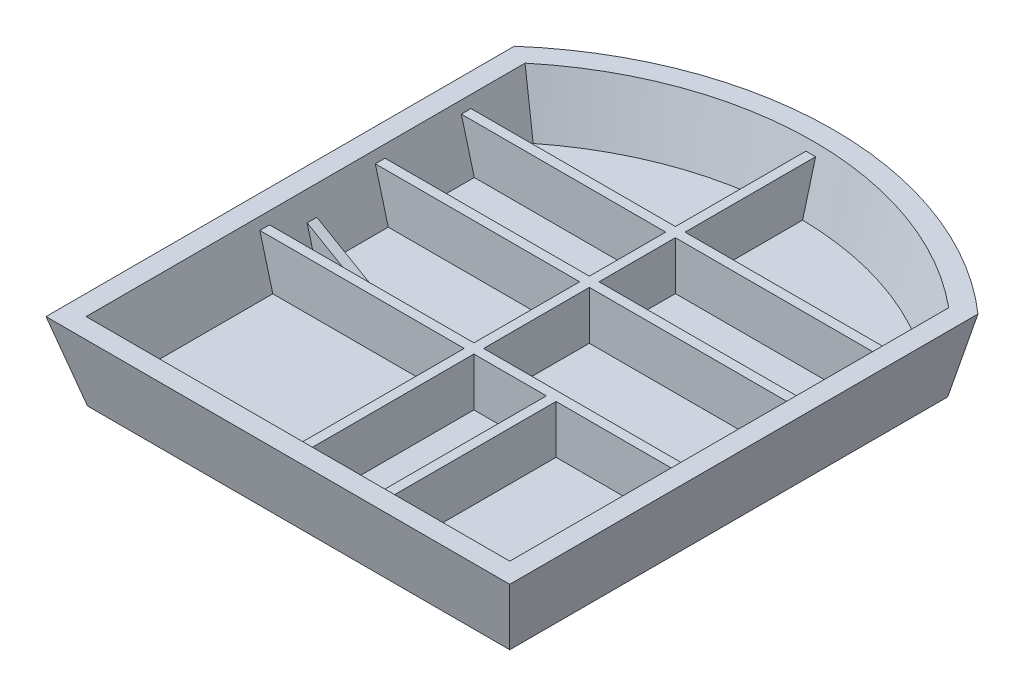
from build123d import *

# Parameters (mm, degrees)
BOSS_EXTRUDE1_DEPTH = 40
BOSS_EXTRUDE1_DRAFT = -15
SHELL1_T            = -10
RIB7_REACH          = 207.359
SKETCH5_WALLS_W     = 5
SKETCH5_WALLS_H     = 549.174801164
SKETCH5_WALLS_W_2   = 496.753269208
SKETCH5_WALLS_H_2   = 5
SKETCH5_WALLS_W_3   = 472.743407243
SKETCH5_WALLS_W_4   = 484.34817386
RIB8_REACH          = 207.359
SKETCH6_WALLS_W     = 5
SKETCH6_WALLS_H     = 444.331737252
RIB9_REACH          = 208.27
SKETCH7_WALL_W      = 435.628467694
SKETCH7_WALL_H      = 5


with BuildPart() as part:
    # Sketch1 → Boss-Extrude1 (with draft: the straight prism first)
    with BuildSketch(Plane(origin=(0, 0, 0), x_dir=(1, 0, 0), z_dir=(0, 1, 0))):
        with BuildLine():
            Line((-109.029856613, -113.081906669), (109.029856613, -113.081906669))
            Line((109.029856613, -113.081906669), (109.029856613, 113.081906669))
            ThreePointArc((109.029856613, 113.081906669), (0, 152.401411753), (-109.029856613, 113.081906669))
            Line((-109.029856613, 113.081906669), (-109.029856613, -113.081906669))
        make_face()
    extrude(amount=BOSS_EXTRUDE1_DEPTH)
    # Boss-Extrude1: the draft: its side faces are tilted about the plane it starts from
    boss_extrude1_sides = [part.faces().sort_by_distance(p)[0] for p in [
        (0, 20, 113.081906669),
        (109.029856613, 20, 0),
        (0, 20, -152.401411753),
        (-109.029856613, 20, 0),
    ]]
    draft(boss_extrude1_sides, Plane(origin=(0, 0, 0), x_dir=(1, 0, 0), z_dir=(0, 1, 0)), BOSS_EXTRUDE1_DRAFT)

    # Shell1
    shell1_openings = [part.faces().sort_by_distance(p)[0] for p in [
        (0, 40, -12.878837242),
    ]]
    offset(amount=SHELL1_T, openings=shell1_openings, kind=Kind.INTERSECTION)

    # Sketch5 walls → Rib7 (add, up to next)
    with BuildSketch(Plane(origin=(0, 35, 0), x_dir=(1, 0, 0), z_dir=(0, 1, 0)), mode=Mode.PRIVATE) as rib7_sk1:
        with Locations((0, 17.67893893)):
            Rectangle(SKETCH5_WALLS_W, SKETCH5_WALLS_H)
    rib7_tool1 = extrude(rib7_sk1.sketch, amount=-RIB7_REACH, mode=Mode.PRIVATE) - part.part
    # Sketch5 walls → Rib7 (add, up to next)
    with BuildSketch(Plane(origin=(0, 35, 0), x_dir=(1, 0, 0), z_dir=(0, 1, 0)), mode=Mode.PRIVATE) as rib7_sk2:
        with Locations((6.802794223, -22.557588079)):
            Rectangle(SKETCH5_WALLS_W_2, SKETCH5_WALLS_H_2)
    rib7_tool2 = extrude(rib7_sk2.sketch, amount=-RIB7_REACH, mode=Mode.PRIVATE) - part.part
    # Sketch5 walls → Rib7 (add, up to next)
    with BuildSketch(Plane(origin=(0, 35, 0), x_dir=(1, 0, 0), z_dir=(0, 1, 0)), mode=Mode.PRIVATE) as rib7_sk3:
        with Locations((2.801150562, 37.066902466)):
            Rectangle(SKETCH5_WALLS_W_3, SKETCH5_WALLS_H_2)
    rib7_tool3 = extrude(rib7_sk3.sketch, amount=-RIB7_REACH, mode=Mode.PRIVATE) - part.part
    # Sketch5 walls → Rib7 (add, up to next)
    with BuildSketch(Plane(origin=(0, 35, 0), x_dir=(1, 0, 0), z_dir=(0, 1, 0)), mode=Mode.PRIVATE) as rib7_sk4:
        with Locations((0.600246549, 81.485147101)):
            Rectangle(SKETCH5_WALLS_W_4, SKETCH5_WALLS_H_2)
    rib7_tool4 = extrude(rib7_sk4.sketch, amount=-RIB7_REACH, mode=Mode.PRIVATE) - part.part
    add(rib7_tool1.solids().sort_by_distance((0, 35, -17.67893893))[0])
    add(rib7_tool2.solids().sort_by_distance((6.802794223, 35, 22.557588079))[0])
    add(rib7_tool3.solids().sort_by_distance((2.801150563, 35, -37.066902466))[0])
    add(rib7_tool4.solids().sort_by_distance((0.600246549, 35, -81.485147101))[0])

    # Sketch6 walls → Rib8 (add, up to next)
    with BuildSketch(Plane(origin=(0, 35, 0), x_dir=(1, 0, 0), z_dir=(0, 1, 0)), mode=Mode.PRIVATE) as rib8_sk1:
        with Locations((42.417422804, -59.172627575)):
            Rectangle(SKETCH6_WALLS_W, SKETCH6_WALLS_H)
    rib8_tool1 = extrude(rib8_sk1.sketch, amount=-RIB8_REACH, mode=Mode.PRIVATE) - part.part
    add(rib8_tool1.solids().sort_by_distance((42.417422804, 35, 59.172627575))[0])

    # Sketch7 wall → Rib9 (add, up to next)
    with BuildSketch(Plane(origin=(-92.409524808, 20.0901507, 0), x_dir=(0.866025403797, -0.499999999978, 0), z_dir=(0.499999999978, 0.866025403797, 0)), mode=Mode.PRIVATE) as rib9_sk1:
        Rectangle(SKETCH7_WALL_W, SKETCH7_WALL_H)
    rib9_tool1 = extrude(rib9_sk1.sketch, amount=-RIB9_REACH, mode=Mode.PRIVATE) - part.part
    add(rib9_tool1.solids().sort_by_distance((-92.409524808, 20.0901507, 0))[0])


solid = part.part
